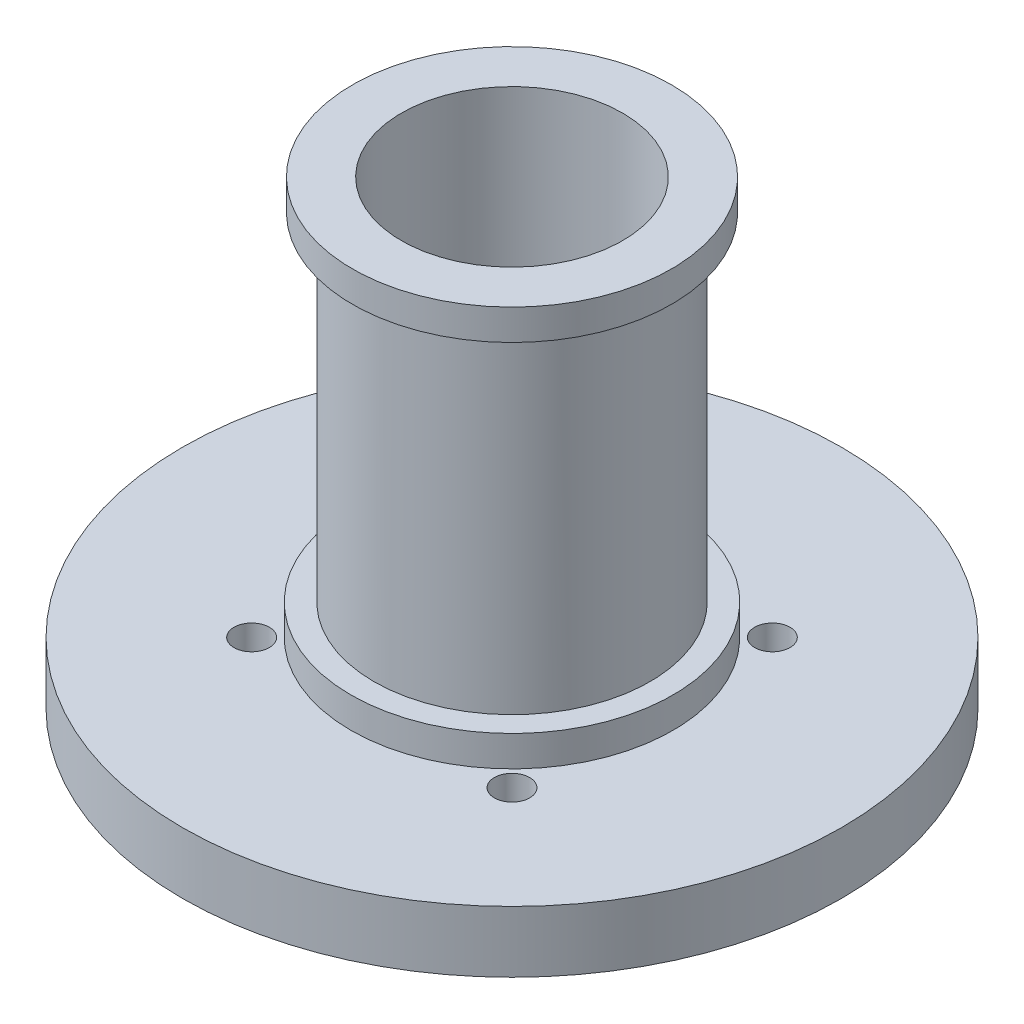
from build123d import *

# Parameters (mm, degrees)
SKETCH3_W          = 2.38125
SKETCH3_H          = 3.175
SKETCH4_R          = 14.2875
SKETCH4_R_2        = 1.8288
HUB_DEPTH          = 7.62
CUT_EXTRUDE1_REACH = 67.585
SKETCH5_R          = 1.8288


with BuildPart() as part:
    # Sketch1 → Axle (revolve)
    with BuildSketch(Plane.XY):
        Polygon((11.44578836, 50.8), (11.44578836, 0), (14.2875, 0), (14.2875, 47.625), (16.51, 47.625), (16.51, 50.8), align=None)
    revolve(axis=Axis((0, 0, 0), (0, 1, 0)))

    # Sketch2 → Gear (revolve)
    with BuildSketch(Plane.XY):
        Polygon((14.2875, 9.525), (14.2875, 6.35), (30.9245, 6.35), (30.9245, 3.175), (34.0995, 3.175), (34.0995, 9.525), align=None)
    revolve(axis=Axis((0, 0, 0), (0, 1, 0)))

    # Sketch3 → Spacer (revolve)
    with BuildSketch(Plane.XY):
        with Locations((15.478125, 11.1125)):
            Rectangle(SKETCH3_W, SKETCH3_H)
    revolve(axis=Axis((0, 0, 0), (0, 1, 0)))

    # Sketch4 → Hub (add)
    with BuildSketch(Plane.XZ.offset(-6.35)):
        with BuildLine():
            Line((-6.35, -22.9362), (6.35, -22.9362))
            Line((6.35, -22.9362), (6.35, -17.463315755))
            ThreePointArc((6.35, -17.463315755), (8.10607195, -14.897970841), (11.133014633, -15.606773503))
            ThreePointArc((11.133014633, -15.606773503), (15.7095197, -15.7095197), (15.606773503, -11.133014633))
            ThreePointArc((15.606773503, -11.133014633), (14.630602978, -9.378248673), (14.906015277, -7.389213596))
            ThreePointArc((14.906015277, -7.389213596), (16.637, 0), (14.906015277, 7.389213596))
            ThreePointArc((14.906015277, 7.389213596), (14.630602978, 9.378248673), (15.606773503, 11.133014633))
            ThreePointArc((15.606773503, 11.133014633), (15.7095197, 15.7095197), (11.133014633, 15.606773503))
            ThreePointArc((11.133014633, 15.606773503), (9.378248673, 14.630602978), (7.389213596, 14.906015277))
            ThreePointArc((7.389213596, 14.906015277), (0, 16.637), (-7.389213596, 14.906015277))
            ThreePointArc((-7.389213596, 14.906015277), (-9.378248673, 14.630602978), (-11.133014633, 15.606773503))
            ThreePointArc((-11.133014633, 15.606773503), (-15.7095197, 15.7095197), (-15.606773503, 11.133014633))
            ThreePointArc((-15.606773503, 11.133014633), (-14.630602978, 9.378248673), (-14.906015277, 7.389213596))
            ThreePointArc((-14.906015277, 7.389213596), (-16.637, 0), (-14.906015277, -7.389213596))
            ThreePointArc((-14.906015277, -7.389213596), (-14.630602978, -9.378248673), (-15.606773503, -11.133014633))
            ThreePointArc((-15.606773503, -11.133014633), (-15.7095197, -15.7095197), (-11.133014633, -15.606773503))
            ThreePointArc((-11.133014633, -15.606773503), (-8.10607195, -14.897970841), (-6.35, -17.463315755))
            Line((-6.35, -17.463315755), (-6.35, -22.9362))
        make_face()
        Circle(SKETCH4_R, mode=Mode.SUBTRACT)
        with Locations((13.470384182, 13.470384182)):
            Circle(SKETCH4_R_2, mode=Mode.SUBTRACT)
        with Locations((-13.470384182, 13.470384182)):
            Circle(SKETCH4_R_2, mode=Mode.SUBTRACT)
        with Locations((-13.470384182, -13.470384182)):
            Circle(SKETCH4_R_2, mode=Mode.SUBTRACT)
        with Locations((13.470384182, -13.470384182)):
            Circle(SKETCH4_R_2, mode=Mode.SUBTRACT)
    extrude(amount=HUB_DEPTH)

    # Sketch5 → Cut-Extrude1 (cut, up to next)
    with BuildSketch(Plane.XZ.offset(-6.35), mode=Mode.PRIVATE) as cut_extrude1_sk1:
        with Locations((-13.470384182, 13.470384182)):
            Circle(SKETCH5_R)
    cut_extrude1_tool1 = extrude(cut_extrude1_sk1.sketch, amount=-CUT_EXTRUDE1_REACH, mode=Mode.PRIVATE) & part.part
    # Sketch5 → Cut-Extrude1 (cut, up to next)
    with BuildSketch(Plane.XZ.offset(-6.35), mode=Mode.PRIVATE) as cut_extrude1_sk2:
        with Locations((13.470384182, 13.470384182)):
            Circle(SKETCH5_R)
    cut_extrude1_tool2 = extrude(cut_extrude1_sk2.sketch, amount=-CUT_EXTRUDE1_REACH, mode=Mode.PRIVATE) & part.part
    # Sketch5 → Cut-Extrude1 (cut, up to next)
    with BuildSketch(Plane.XZ.offset(-6.35), mode=Mode.PRIVATE) as cut_extrude1_sk3:
        with Locations((13.470384182, -13.470384182)):
            Circle(SKETCH5_R)
    cut_extrude1_tool3 = extrude(cut_extrude1_sk3.sketch, amount=-CUT_EXTRUDE1_REACH, mode=Mode.PRIVATE) & part.part
    # Sketch5 → Cut-Extrude1 (cut, up to next)
    with BuildSketch(Plane.XZ.offset(-6.35), mode=Mode.PRIVATE) as cut_extrude1_sk4:
        with Locations((-13.470384182, -13.470384182)):
            Circle(SKETCH5_R)
    cut_extrude1_tool4 = extrude(cut_extrude1_sk4.sketch, amount=-CUT_EXTRUDE1_REACH, mode=Mode.PRIVATE) & part.part
    add(cut_extrude1_tool1.solids().sort_by_distance((-13.470384, 6.35, 13.470384))[0], mode=Mode.SUBTRACT)
    add(cut_extrude1_tool2.solids().sort_by_distance((13.470384, 6.35, 13.470384))[0], mode=Mode.SUBTRACT)
    add(cut_extrude1_tool3.solids().sort_by_distance((13.470384, 6.35, -13.470384))[0], mode=Mode.SUBTRACT)
    add(cut_extrude1_tool4.solids().sort_by_distance((-13.470384, 6.35, -13.470384))[0], mode=Mode.SUBTRACT)


solid = part.part
